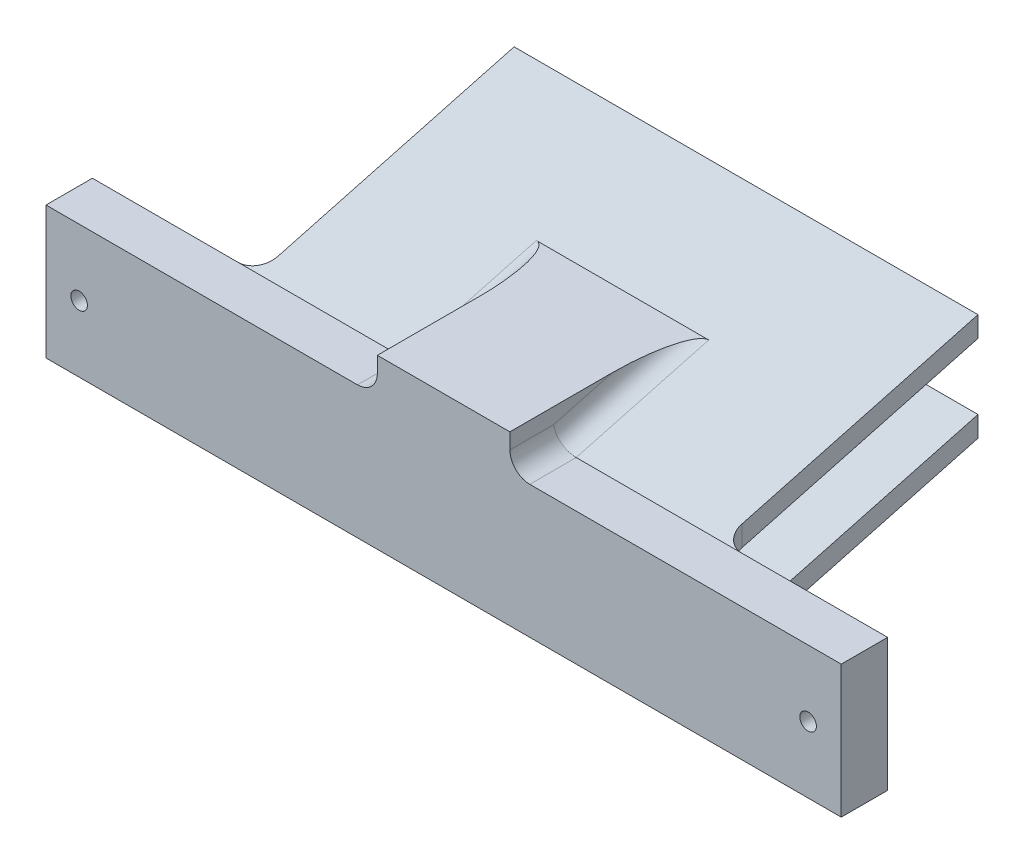
from build123d import *

# Parameters (mm, degrees)
SKETCH1_W           = 152.4
SKETCH1_H           = 25.4
SKETCH1_R           = 1.5875
BOSS_EXTRUDE1_DEPTH = 8.89
BOSS_EXTRUDE2_DEPTH = 44.45
BOSS_EXTRUDE3_DEPTH = 12.7
FILLET1_R           = 3.81


with BuildPart() as part:
    # Sketch1 → Boss-Extrude1 (new body)
    with BuildSketch(Plane.XY):
        Rectangle(SKETCH1_W, SKETCH1_H)
        with Locations((-69.85, 0)):
            Circle(SKETCH1_R, mode=Mode.SUBTRACT)
        with Locations(Location((69.85, 0, 0), (0, 0, 180))):
            Circle(SKETCH1_R, mode=Mode.SUBTRACT)
    extrude(amount=BOSS_EXTRUDE1_DEPTH)

    # Sketch2 → Boss-Extrude2 (add, symmetric)
    with BuildSketch(Plane(origin=(0, 0, 0), x_dir=(0, 0, -1), z_dir=(1, 0, 0))):
        Polygon((0, 8.755597753), (0, 12.7), (49.069031975, 25.848007491), (49.069031975, 21.903605244), align=None)
        Polygon((0, -3.866489439), (0, -7.810891686), (49.069031975, 5.337115805), (49.069031975, 9.281518052), align=None)
    extrude(amount=BOSS_EXTRUDE2_DEPTH, both=True)

    # Sketch3 → Boss-Extrude3 (add, symmetric)
    with BuildSketch(Plane(origin=(0, 0, 0), x_dir=(0, 0, -1), z_dir=(1, 0, 0))):
        Polygon((-8.89, 12.7), (-8.89, 19.505909488), (25.4, 19.505909488), (0, 12.7), align=None)
        Polygon((25.4, -1.004982199), (0, -12.7), (0, -7.810891686), align=None)
    extrude(amount=BOSS_EXTRUDE3_DEPTH, both=True)

    # Fillet1
    # the kernel refuses this fillet: 3.81 mm, written as the material it adds along each edge
    with BuildSketch(Plane(origin=(16.51, -10.73440751, -3.81), x_dir=(0, 0, 1), z_dir=(-1, 0, 0))) as fillet1_piece_1_section:
        Polygon((0, 0), (FILLET1_R, 0), (FILLET1_R, FILLET1_R * 0.767326987979), (FILLET1_R * 0.258819045103, FILLET1_R * 0.965925826289), align=None)
    fillet1_piece_1 = extrude(amount=FILLET1_R, mode=Mode.PRIVATE)
    fillet1_piece_1 = fillet1_piece_1 - Plane(origin=(16.51, -10.73440751, -3.81), x_dir=(0, -0.6087614290087219, -0.7933533402912344), z_dir=(-1, 0, 0)) * Sphere(FILLET1_R, mode=Mode.PRIVATE)
    add(fillet1_piece_1)
    with BuildSketch(Plane(origin=(-16.51, -10.73440751, -3.81), x_dir=(0, 0, 1), z_dir=(1, 0, 0))) as fillet1_piece_2_section:
        Polygon((0, 0), (FILLET1_R, 0), (FILLET1_R, -FILLET1_R * 0.767326987979), (FILLET1_R * 0.258819045103, -FILLET1_R * 0.965925826289), align=None)
    fillet1_piece_2 = extrude(amount=FILLET1_R, mode=Mode.PRIVATE)
    fillet1_piece_2 = fillet1_piece_2 - Plane(origin=(-16.51, -10.73440751, -3.81), x_dir=(0, -0.6087614290087219, -0.7933533402912344), z_dir=(1, 0, 0)) * Sphere(FILLET1_R, mode=Mode.PRIVATE)
    add(fillet1_piece_2)
    with BuildSketch(Plane(origin=(-44.45, 8.755597753, 0), x_dir=(0, -1, 0), z_dir=(1, 0, 0))) as fillet1_piece_3:
        with BuildLine():
            CenterArc((FILLET1_R * 0.767326987979, FILLET1_R), FILLET1_R, 195, 75)
            Line((-FILLET1_R * 0.19859883831, FILLET1_R * 0.741180954897), (0, 0))
            Line((0, 0), (FILLET1_R * 0.767326987979, 0))
        make_face()
    extrude(amount=88.9)
    with BuildSketch(Plane(origin=(-44.45, -0.769402247, 0), x_dir=(-1, 0, 0), z_dir=(0, 1, 0))) as fillet1_piece_4_section:
        with BuildLine():
            CenterArc((FILLET1_R, -FILLET1_R), FILLET1_R, 90, 90)
            Line((0, -FILLET1_R), (0, 0))
            Line((0, 0), (FILLET1_R, 0))
        make_face()
    fillet1_piece_4 = extrude(amount=13.469402247, mode=Mode.PRIVATE)
    fillet1_piece_4 = split(fillet1_piece_4, bisect_by=Plane(origin=(-45.341111067, 12.778682572, -0.293647356), z_dir=(0, -0.9659258262890691, -0.25881904510251785)), keep=Keep.TOP, mode=Mode.PRIVATE)
    fillet1_piece_4 = split(fillet1_piece_4, bisect_by=Plane(origin=(-45.341111067, 9.098505174, -1.279747918), z_dir=(0, 0.9659258262890691, 0.258819045102518)), keep=Keep.TOP, mode=Mode.PRIVATE)
    add(fillet1_piece_4)
    with BuildSketch(Plane(origin=(-44.45, -0.769402247, 0), x_dir=(-1, 0, 0), z_dir=(0, 1, 0))) as fillet1_piece_5_section:
        with BuildLine():
            CenterArc((FILLET1_R, -FILLET1_R), FILLET1_R, 90, 90)
            Line((0, -FILLET1_R), (0, 0))
            Line((0, 0), (FILLET1_R, 0))
        make_face()
    fillet1_piece_5 = extrude(amount=22.994402247, mode=Mode.PRIVATE)
    fillet1_piece_5 = split(fillet1_piece_5, bisect_by=Plane(origin=(-44.855660273, 12.7, -1.638749777), z_dir=(0, 1, 0)), keep=Keep.TOP, mode=Mode.PRIVATE)
    fillet1_piece_5 = split(fillet1_piece_5, bisect_by=Plane(origin=(-44.855660273, 13.124394562, -1.583862067), z_dir=(0, -0.9659258262890691, -0.25881904510251785)), keep=Keep.TOP, mode=Mode.PRIVATE)
    add(fillet1_piece_5)
    with BuildSketch(Plane(origin=(44.45, -0.769402247, 0), x_dir=(1, 0, 0), z_dir=(0, 1, 0))) as fillet1_piece_6_section:
        with BuildLine():
            CenterArc((FILLET1_R, FILLET1_R), FILLET1_R, 180, 90)
            Line((0, FILLET1_R), (0, 0))
            Line((0, 0), (FILLET1_R, 0))
        make_face()
    fillet1_piece_6 = extrude(amount=13.469402247, mode=Mode.PRIVATE)
    fillet1_piece_6 = split(fillet1_piece_6, bisect_by=Plane(origin=(45.341111067, 9.098505174, -1.279747918), z_dir=(0, 0.9659258262890691, 0.258819045102518)), keep=Keep.TOP, mode=Mode.PRIVATE)
    fillet1_piece_6 = split(fillet1_piece_6, bisect_by=Plane(origin=(45.341111067, 12.778682572, -0.293647356), z_dir=(0, -0.9659258262890691, -0.25881904510251785)), keep=Keep.TOP, mode=Mode.PRIVATE)
    add(fillet1_piece_6)
    with BuildSketch(Plane(origin=(44.45, -0.769402247, 0), x_dir=(1, 0, 0), z_dir=(0, 1, 0))) as fillet1_piece_7_section:
        with BuildLine():
            CenterArc((FILLET1_R, FILLET1_R), FILLET1_R, 180, 90)
            Line((0, FILLET1_R), (0, 0))
            Line((0, 0), (FILLET1_R, 0))
        make_face()
    fillet1_piece_7 = extrude(amount=22.994402247, mode=Mode.PRIVATE)
    fillet1_piece_7 = split(fillet1_piece_7, bisect_by=Plane(origin=(44.855660273, 12.7, -1.638749777), z_dir=(0, 1, 0)), keep=Keep.TOP, mode=Mode.PRIVATE)
    fillet1_piece_7 = split(fillet1_piece_7, bisect_by=Plane(origin=(44.855660273, 13.124394562, -1.583862067), z_dir=(0, -0.9659258262890691, -0.25881904510251785)), keep=Keep.TOP, mode=Mode.PRIVATE)
    add(fillet1_piece_7)
    with BuildSketch(Plane(origin=(-44.45, 5.658510561, 0), x_dir=(-1, 0, 0), z_dir=(0, -1, 0))) as fillet1_piece_8_section:
        with BuildLine():
            CenterArc((FILLET1_R, FILLET1_R), FILLET1_R, 180, 90)
            Line((0, FILLET1_R), (0, 0))
            Line((0, 0), (FILLET1_R, 0))
        make_face()
    fillet1_piece_8 = extrude(amount=22.994402247, mode=Mode.PRIVATE)
    fillet1_piece_8 = split(fillet1_piece_8, bisect_by=Plane(origin=(-45.312565385, -7.447655563, -1.355615666), z_dir=(0, 0.9659258262890691, 0.25881904510251813)), keep=Keep.TOP, mode=Mode.PRIVATE)
    fillet1_piece_8 = split(fillet1_piece_8, bisect_by=Plane(origin=(-45.312565385, -3.767478165, -0.369515104), z_dir=(0, -0.9659258262890691, -0.2588190451025181)), keep=Keep.TOP, mode=Mode.PRIVATE)
    add(fillet1_piece_8)
    with BuildSketch(Plane(origin=(44.45, -3.866489439, 0), x_dir=(0, 1, 0), z_dir=(-1, 0, 0))) as fillet1_piece_9:
        with BuildLine():
            CenterArc((FILLET1_R * 1.30322537284, FILLET1_R), FILLET1_R, 165, 105)
            Line((FILLET1_R * 0.337299546552, FILLET1_R * 1.2588190451), (0, 0))
            Line((0, 0), (FILLET1_R * 1.30322537284, 0))
        make_face()
    extrude(amount=88.9)
    with BuildSketch(Plane(origin=(16.51, -7.810891686, 0), x_dir=(0, -1, 0), z_dir=(1, 0, 0)), Plane(origin=(-44.45, -7.810891686, 0), x_dir=(0, -1, 0), z_dir=(1, 0, 0))) as fillet1_piece_10:
        with BuildLine():
            CenterArc((FILLET1_R * 0.767326987979, FILLET1_R), FILLET1_R, 195, 75)
            Line((-FILLET1_R * 0.19859883831, FILLET1_R * 0.741180954897), (0, 0))
            Line((0, 0), (FILLET1_R * 0.767326987979, 0))
        make_face()
    extrude(amount=27.94)
    with BuildSketch(Plane(origin=(44.45, 5.658510561, 0), x_dir=(1, 0, 0), z_dir=(0, -1, 0))) as fillet1_piece_11_section:
        with BuildLine():
            CenterArc((FILLET1_R, -FILLET1_R), FILLET1_R, 90, 90)
            Line((0, -FILLET1_R), (0, 0))
            Line((0, 0), (FILLET1_R, 0))
        make_face()
    fillet1_piece_11 = extrude(amount=22.994402247, mode=Mode.PRIVATE)
    fillet1_piece_11 = split(fillet1_piece_11, bisect_by=Plane(origin=(45.312565385, -7.447655563, -1.355615666), z_dir=(0, 0.9659258262890691, 0.25881904510251813)), keep=Keep.TOP, mode=Mode.PRIVATE)
    fillet1_piece_11 = split(fillet1_piece_11, bisect_by=Plane(origin=(45.312565385, -3.767478165, -0.369515104), z_dir=(0, -0.9659258262890691, -0.2588190451025181)), keep=Keep.TOP, mode=Mode.PRIVATE)
    add(fillet1_piece_11)
    with BuildSketch(Plane(origin=(-12.7, 12.7, -9.525), x_dir=(-1, 0, 0), z_dir=(0, 0, 1))) as fillet1_piece_12:
        with BuildLine():
            CenterArc((FILLET1_R, -FILLET1_R), FILLET1_R, 90, 90)
            Line((0, -FILLET1_R), (0, 0))
            Line((0, 0), (FILLET1_R, 0))
        make_face()
    extrude(amount=18.415)
    with BuildSketch(Plane(origin=(-12.7, 21.971160892, -34.600443495), x_dir=(0, 0.9659258262890691, 0.2588190451025179), z_dir=(0, -0.2588190451025179, 0.9659258262890691))) as fillet1_piece_13_section:
        with BuildLine():
            CenterArc((FILLET1_R, FILLET1_R), FILLET1_R, 180, 90)
            Line((0, FILLET1_R), (0, 0))
            Line((0, 0), (FILLET1_R, 0))
        make_face()
    fillet1_piece_13 = extrude(amount=45.346014982, mode=Mode.PRIVATE)
    fillet1_piece_13 = split(fillet1_piece_13, bisect_by=Plane(origin=(-13.567705221, 16.120661603, 8.89), z_dir=(0, 0, -1)), keep=Keep.TOP, mode=Mode.PRIVATE)
    fillet1_piece_13 = split(fillet1_piece_13, bisect_by=Plane(origin=(-13.567705221, 19.505909488, -9.486038737), z_dir=(0, -1, 0)), keep=Keep.TOP, mode=Mode.PRIVATE)
    add(fillet1_piece_13)
    with BuildSketch(Plane(origin=(12.7, 12.7, -9.525), x_dir=(1, 0, 0), z_dir=(0, 0, 1))) as fillet1_piece_14:
        with BuildLine():
            CenterArc((FILLET1_R, FILLET1_R), FILLET1_R, 180, 90)
            Line((0, FILLET1_R), (0, 0))
            Line((0, 0), (FILLET1_R, 0))
        make_face()
    extrude(amount=18.415)
    with BuildSketch(Plane(origin=(12.7, 21.971160892, -34.600443495), x_dir=(1, 0, 0), z_dir=(0, -0.2588190451025179, 0.9659258262890691))) as fillet1_piece_15_section:
        with BuildLine():
            CenterArc((FILLET1_R, FILLET1_R), FILLET1_R, 180, 90)
            Line((0, FILLET1_R), (0, 0))
            Line((0, 0), (FILLET1_R, 0))
        make_face()
    fillet1_piece_15 = extrude(amount=45.346014982, mode=Mode.PRIVATE)
    fillet1_piece_15 = split(fillet1_piece_15, bisect_by=Plane(origin=(13.56770522, 16.120661606, 8.89), z_dir=(0, 0, -1)), keep=Keep.TOP, mode=Mode.PRIVATE)
    fillet1_piece_15 = split(fillet1_piece_15, bisect_by=Plane(origin=(13.56770522, 19.505909488, -9.486038751), z_dir=(0, -1, 0)), keep=Keep.TOP, mode=Mode.PRIVATE)
    add(fillet1_piece_15)
    with BuildSketch(Plane(origin=(-12.7, -7.054230112, -2.823899438), x_dir=(-1, 0, 0), z_dir=(0, 0.2588190451025182, -0.965925826289069))) as fillet1_piece_16_section:
        with BuildLine():
            CenterArc((FILLET1_R, -FILLET1_R), FILLET1_R, 90, 90)
            Line((0, -FILLET1_R), (0, 0))
            Line((0, 0), (FILLET1_R, 0))
        make_face()
    fillet1_piece_16 = extrude(amount=32.897499158, mode=Mode.PRIVATE)
    fillet1_piece_16 = split(fillet1_piece_16, bisect_by=Plane(origin=(-13.689407804, -6.647394043, -13.145443122), z_dir=(0, 0.9083408023896492, 0.41823078164349436)), keep=Keep.TOP, mode=Mode.PRIVATE)
    add(fillet1_piece_16)
    with BuildSketch(Plane(origin=(-12.7, -12.7, 0), x_dir=(-1, 0, 0), z_dir=(0, 1, 0))) as fillet1_piece_17_section:
        with BuildLine():
            CenterArc((FILLET1_R, -FILLET1_R), FILLET1_R, 90, 90)
            Line((0, -FILLET1_R), (0, 0))
            Line((0, 0), (FILLET1_R, 0))
        make_face()
    fillet1_piece_17 = extrude(amount=1.96559249, mode=Mode.PRIVATE)
    fillet1_piece_17 = split(fillet1_piece_17, bisect_by=Plane(origin=(-13.67877404, -12.248464892, -0.980673303), z_dir=(0, 0.9083408023896492, 0.41823078164349436)), keep=Keep.TOP, mode=Mode.PRIVATE)
    add(fillet1_piece_17)
    with BuildSketch(Plane(origin=(12.7, -7.054230112, -2.823899438), x_dir=(0, -0.965925826289069, -0.2588190451025182), z_dir=(0, 0.2588190451025182, -0.965925826289069))) as fillet1_piece_18_section:
        with BuildLine():
            CenterArc((FILLET1_R, -FILLET1_R), FILLET1_R, 90, 90)
            Line((0, -FILLET1_R), (0, 0))
            Line((0, 0), (FILLET1_R, 0))
        make_face()
    fillet1_piece_18 = extrude(amount=32.897499158, mode=Mode.PRIVATE)
    fillet1_piece_18 = split(fillet1_piece_18, bisect_by=Plane(origin=(13.689407804, -6.647394043, -13.145443122), z_dir=(0, 0.9083408023896492, 0.41823078164349436)), keep=Keep.TOP, mode=Mode.PRIVATE)
    add(fillet1_piece_18)
    with BuildSketch(Plane(origin=(12.7, -12.7, 0), x_dir=(1, 0, 0), z_dir=(0, 1, 0))) as fillet1_piece_19_section:
        with BuildLine():
            CenterArc((FILLET1_R, FILLET1_R), FILLET1_R, 180, 90)
            Line((0, FILLET1_R), (0, 0))
            Line((0, 0), (FILLET1_R, 0))
        make_face()
    fillet1_piece_19 = extrude(amount=1.96559249, mode=Mode.PRIVATE)
    fillet1_piece_19 = split(fillet1_piece_19, bisect_by=Plane(origin=(13.67877404, -12.248464892, -0.980673303), z_dir=(0, 0.9083408023896492, 0.41823078164349436)), keep=Keep.TOP, mode=Mode.PRIVATE)
    add(fillet1_piece_19)
    with BuildSketch(Plane(origin=(-44.45, -0.769402247, 0), x_dir=(-1, 0, 0), z_dir=(0, 1, 0))) as fillet1_piece_20a_section:
        with BuildLine():
            CenterArc((FILLET1_R, -FILLET1_R), FILLET1_R, 90, 90)
            Line((0, -FILLET1_R), (0, 0))
            Line((0, 0), (FILLET1_R, 0))
        make_face()
    fillet1_piece_20a = extrude(amount=13.469402247, mode=Mode.PRIVATE)
    fillet1_piece_20a = split(fillet1_piece_20a, bisect_by=Plane(origin=(-45.301618927, 8.664751894, 0.339041359), z_dir=(0, -0.9659258262890691, -0.258819045102518)), keep=Keep.TOP, mode=Mode.PRIVATE)
    with BuildSketch(Plane(origin=(-51.75878956, 8.755597753, 0), x_dir=(0, -1, 0), z_dir=(1, 0, 0))) as fillet1_piece_20b_section:
        with BuildLine():
            CenterArc((FILLET1_R * 0.767326987979, FILLET1_R), FILLET1_R, 195, 75)
            Line((-FILLET1_R * 0.19859883831, FILLET1_R * 0.741180954897), (0, 0))
            Line((0, 0), (FILLET1_R * 0.767326987979, 0))
        make_face()
    fillet1_piece_20b = extrude(amount=96.20878956, mode=Mode.PRIVATE)
    fillet1_piece_20b = split(fillet1_piece_20b, bisect_by=Plane(origin=(-44.45, 8.277292098, -0.623340065), z_dir=(-1, 0, 0)), keep=Keep.TOP, mode=Mode.PRIVATE)
    fillet1_piece_20 = fillet1_piece_20a & fillet1_piece_20b
    add(fillet1_piece_20)
    with BuildSketch(Plane(origin=(-44.45, 8.755597753, 0), x_dir=(0, -1, 0), z_dir=(1, 0, 0))) as fillet1_piece_21a_section:
        with BuildLine():
            CenterArc((FILLET1_R * 0.767326987979, FILLET1_R), FILLET1_R, 195, 75)
            Line((-FILLET1_R * 0.19859883831, FILLET1_R * 0.741180954897), (0, 0))
            Line((0, 0), (FILLET1_R * 0.767326987979, 0))
        make_face()
    fillet1_piece_21a = extrude(amount=96.20878956, mode=Mode.PRIVATE)
    fillet1_piece_21a = split(fillet1_piece_21a, bisect_by=Plane(origin=(44.45, 8.277292098, -0.623340065), z_dir=(1, 0, 0)), keep=Keep.TOP, mode=Mode.PRIVATE)
    with BuildSketch(Plane(origin=(44.45, -0.769402247, 0), x_dir=(1, 0, 0), z_dir=(0, 1, 0))) as fillet1_piece_21b_section:
        with BuildLine():
            CenterArc((FILLET1_R, FILLET1_R), FILLET1_R, 180, 90)
            Line((0, FILLET1_R), (0, 0))
            Line((0, 0), (FILLET1_R, 0))
        make_face()
    fillet1_piece_21b = extrude(amount=13.469402247, mode=Mode.PRIVATE)
    fillet1_piece_21b = split(fillet1_piece_21b, bisect_by=Plane(origin=(45.301618927, 8.664751894, 0.339041359), z_dir=(0, -0.9659258262890691, -0.258819045102518)), keep=Keep.TOP, mode=Mode.PRIVATE)
    fillet1_piece_21 = fillet1_piece_21a & fillet1_piece_21b
    add(fillet1_piece_21)
    with BuildSketch(Plane(origin=(44.45, -3.866489439, 0), x_dir=(0, 1, 0), z_dir=(-1, 0, 0))) as fillet1_piece_22a_section:
        with BuildLine():
            CenterArc((FILLET1_R * 1.30322537284, FILLET1_R), FILLET1_R, 165, 105)
            Line((FILLET1_R * 0.337299546552, FILLET1_R * 1.2588190451), (0, 0))
            Line((0, 0), (FILLET1_R * 1.30322537284, 0))
        make_face()
    fillet1_piece_22a = extrude(amount=101.313221676, mode=Mode.PRIVATE)
    fillet1_piece_22a = split(fillet1_piece_22a, bisect_by=Plane(origin=(-44.45, -2.401293956, -1.124284037), z_dir=(-1, 0, 0)), keep=Keep.TOP, mode=Mode.PRIVATE)
    with BuildSketch(Plane(origin=(-44.45, 5.658510561, 0), x_dir=(-1, 0, 0), z_dir=(0, -1, 0))) as fillet1_piece_22b_section:
        with BuildLine():
            CenterArc((FILLET1_R, FILLET1_R), FILLET1_R, 180, 90)
            Line((0, FILLET1_R), (0, 0))
            Line((0, 0), (FILLET1_R, 0))
        make_face()
    fillet1_piece_22b = extrude(amount=22.994402247, mode=Mode.PRIVATE)
    fillet1_piece_22b = split(fillet1_piece_22b, bisect_by=Plane(origin=(-45.324056285, -3.329117204, -2.005500483), z_dir=(0, 0.9659258262890691, 0.2588190451025181)), keep=Keep.TOP, mode=Mode.PRIVATE)
    fillet1_piece_22 = fillet1_piece_22a & fillet1_piece_22b
    add(fillet1_piece_22)
    with BuildSketch(Plane(origin=(-44.45, 5.658510561, 0), x_dir=(-1, 0, 0), z_dir=(0, -1, 0))) as fillet1_piece_23a_section:
        with BuildLine():
            CenterArc((FILLET1_R, FILLET1_R), FILLET1_R, 180, 90)
            Line((0, FILLET1_R), (0, 0))
            Line((0, 0), (FILLET1_R, 0))
        make_face()
    fillet1_piece_23a = extrude(amount=22.994402247, mode=Mode.PRIVATE)
    fillet1_piece_23a = split(fillet1_piece_23a, bisect_by=Plane(origin=(-45.291707933, -12.7, -0.897871299), z_dir=(0, 1, 0)), keep=Keep.TOP, mode=Mode.PRIVATE)
    fillet1_piece_23a = split(fillet1_piece_23a, bisect_by=Plane(origin=(-45.291707933, -7.742119907, -0.256659773), z_dir=(0, -0.9659258262890691, -0.25881904510251813)), keep=Keep.TOP, mode=Mode.PRIVATE)
    with BuildSketch(Plane(origin=(-51.75878956, -7.810891686, 0), x_dir=(0, -1, 0), z_dir=(1, 0, 0))) as fillet1_piece_23b_section:
        with BuildLine():
            CenterArc((FILLET1_R * 0.767326987979, FILLET1_R), FILLET1_R, 195, 75)
            Line((-FILLET1_R * 0.19859883831, FILLET1_R * 0.741180954897), (0, 0))
            Line((0, 0), (FILLET1_R * 0.767326987979, 0))
        make_face()
    fillet1_piece_23b = extrude(amount=35.24878956, mode=Mode.PRIVATE)
    fillet1_piece_23b = split(fillet1_piece_23b, bisect_by=Plane(origin=(-44.45, -8.289197341, -0.623340065), z_dir=(-1, 0, 0)), keep=Keep.TOP, mode=Mode.PRIVATE)
    fillet1_piece_23 = fillet1_piece_23a & fillet1_piece_23b
    add(fillet1_piece_23)
    with BuildSketch(Plane(origin=(44.45, 5.658510561, 0), x_dir=(1, 0, 0), z_dir=(0, -1, 0))) as fillet1_piece_24a_section:
        with BuildLine():
            CenterArc((FILLET1_R, -FILLET1_R), FILLET1_R, 90, 90)
            Line((0, -FILLET1_R), (0, 0))
            Line((0, 0), (FILLET1_R, 0))
        make_face()
    fillet1_piece_24a = extrude(amount=22.994402247, mode=Mode.PRIVATE)
    fillet1_piece_24a = split(fillet1_piece_24a, bisect_by=Plane(origin=(45.324056285, -3.329117204, -2.005500483), z_dir=(0, 0.9659258262890691, 0.2588190451025181)), keep=Keep.TOP, mode=Mode.PRIVATE)
    with BuildSketch(Plane(origin=(56.863221676, -3.866489439, 0), x_dir=(0, 1, 0), z_dir=(-1, 0, 0))) as fillet1_piece_24b_section:
        with BuildLine():
            CenterArc((FILLET1_R * 1.30322537284, FILLET1_R), FILLET1_R, 165, 105)
            Line((FILLET1_R * 0.337299546552, FILLET1_R * 1.2588190451), (0, 0))
            Line((0, 0), (FILLET1_R * 1.30322537284, 0))
        make_face()
    fillet1_piece_24b = extrude(amount=101.313221676, mode=Mode.PRIVATE)
    fillet1_piece_24b = split(fillet1_piece_24b, bisect_by=Plane(origin=(44.45, -2.401293956, -1.124284037), z_dir=(1, 0, 0)), keep=Keep.TOP, mode=Mode.PRIVATE)
    fillet1_piece_24 = fillet1_piece_24a & fillet1_piece_24b
    add(fillet1_piece_24)
    with BuildSketch(Plane(origin=(16.51, -7.810891686, 0), x_dir=(0, -1, 0), z_dir=(1, 0, 0))) as fillet1_piece_25a_section:
        with BuildLine():
            CenterArc((FILLET1_R * 0.767326987979, FILLET1_R), FILLET1_R, 195, 75)
            Line((-FILLET1_R * 0.19859883831, FILLET1_R * 0.741180954897), (0, 0))
            Line((0, 0), (FILLET1_R * 0.767326987979, 0))
        make_face()
    fillet1_piece_25a = extrude(amount=35.24878956, mode=Mode.PRIVATE)
    fillet1_piece_25a = split(fillet1_piece_25a, bisect_by=Plane(origin=(44.45, -8.289197341, -0.623340065), z_dir=(1, 0, 0)), keep=Keep.TOP, mode=Mode.PRIVATE)
    with BuildSketch(Plane(origin=(44.45, 5.658510561, 0), x_dir=(1, 0, 0), z_dir=(0, -1, 0))) as fillet1_piece_25b_section:
        with BuildLine():
            CenterArc((FILLET1_R, -FILLET1_R), FILLET1_R, 90, 90)
            Line((0, -FILLET1_R), (0, 0))
            Line((0, 0), (FILLET1_R, 0))
        make_face()
    fillet1_piece_25b = extrude(amount=22.994402247, mode=Mode.PRIVATE)
    fillet1_piece_25b = split(fillet1_piece_25b, bisect_by=Plane(origin=(45.291707933, -12.7, -0.897871299), z_dir=(0, 1, 0)), keep=Keep.TOP, mode=Mode.PRIVATE)
    fillet1_piece_25b = split(fillet1_piece_25b, bisect_by=Plane(origin=(45.291707933, -7.742119907, -0.256659773), z_dir=(0, -0.9659258262890691, -0.25881904510251813)), keep=Keep.TOP, mode=Mode.PRIVATE)
    fillet1_piece_25 = fillet1_piece_25a & fillet1_piece_25b
    add(fillet1_piece_25)


solid = part.part
